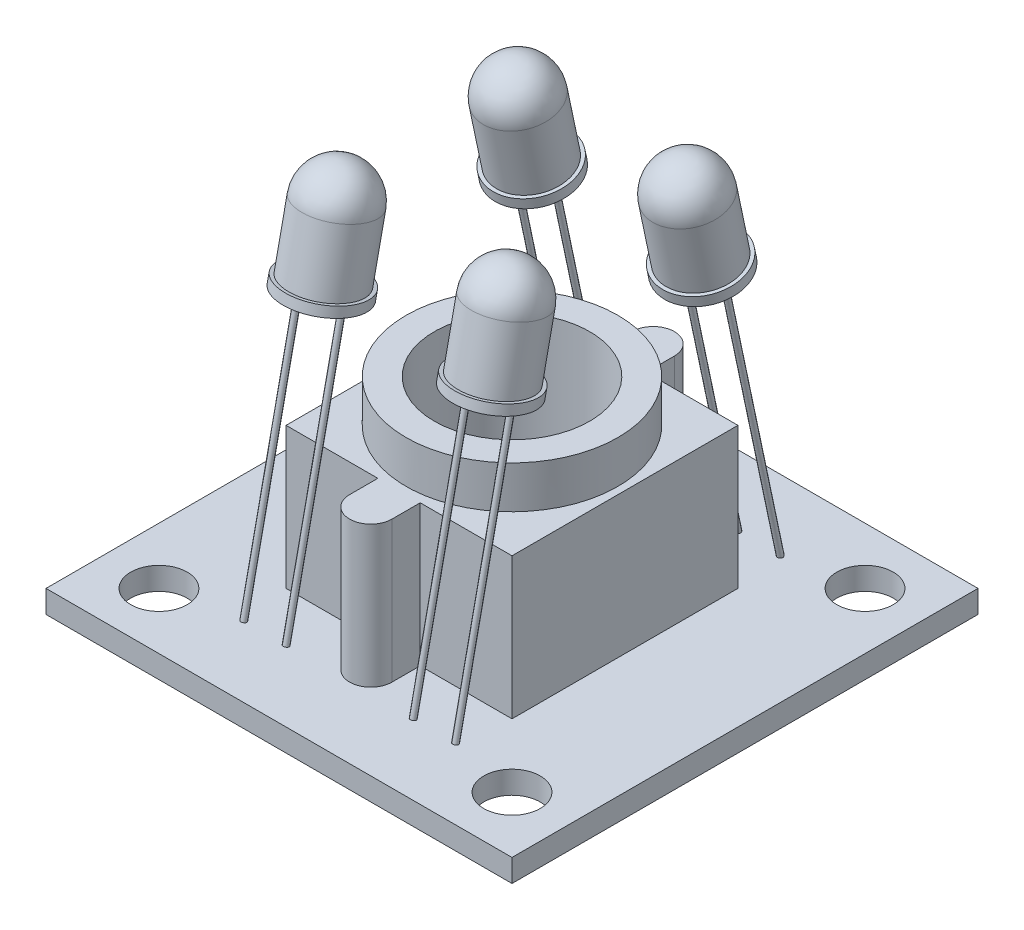
from build123d import *

# Parameters (mm, degrees)
SKETCH1_W                 = 33
SKETCH1_H                 = 33
SKETCH1_R                 = 2
BOSS_EXTRUDE1_DEPTH       = 1.6
SKETCH2_W                 = 16
SKETCH2_H                 = 16
BOSS_EXTRUDE2_DEPTH       = 10
BOSS_EXTRUDE3_START       = -10
BOSS_EXTRUDE3_DEPTH       = 10
SKETCH4_R                 = 7.5
SKETCH4_R_2               = 5.5
BOSS_EXTRUDE4_DEPTH       = 3
CUT_EXTRUDE1_START        = -8
SKETCH5_R                 = 5.5
CUT_EXTRUDE1_DEPTH        = 8
SKETCH7_R                 = 0.2
LPATTERN1_COUNT           = 2
LPATTERN1_PITCH           = 3
SKETCH8_R                 = 2.75
BOSS_EXTRUDE7_DEPTH       = 0.7
SKETCH9_R                 = 2.5
BOSS_EXTRUDE8_DEPTH       = 7
FILLET1_R                 = 2.5
LPATTERN2_COUNT           = 2
LPATTERN2_PITCH           = 12
LPATTERN2_COPY_1_SKETCH_R = 0.2
FILLET1_OF_LPATTERN2_R    = 2.5


# Read off the part's stored shape, not the designer's step: Mirror1
with BuildPart() as part:
    # Sketch1 → Boss-Extrude1 (new body)
    with BuildSketch(Plane(origin=(0, 0, 0), x_dir=(1, 0, 0), z_dir=(0, 1, 0))):
        Rectangle(SKETCH1_W, SKETCH1_H)
        with Locations(Location((-12.5, 12.5, 0), (0, 0, 270))):
            Circle(SKETCH1_R, mode=Mode.SUBTRACT)
        with Locations(Location((12.5, 12.5, 0), (0, 0, 270))):
            Circle(SKETCH1_R, mode=Mode.SUBTRACT)
        with Locations(Location((12.5, -12.5, 0), (0, 0, 270))):
            Circle(SKETCH1_R, mode=Mode.SUBTRACT)
        with Locations(Location((-12.5, -12.5, 0), (0, 0, 270))):
            Circle(SKETCH1_R, mode=Mode.SUBTRACT)
    extrude(amount=BOSS_EXTRUDE1_DEPTH)

    # Sketch2 → Boss-Extrude2 (add)
    with BuildSketch(Plane(origin=(0, 1.6, 0), x_dir=(1, 0, 0), z_dir=(0, 1, 0))):
        Rectangle(SKETCH2_W, SKETCH2_H)
    extrude(amount=BOSS_EXTRUDE2_DEPTH)

    # Sketch3 → Boss-Extrude3 (add)
    with BuildSketch(Plane(origin=(0, 11.6, 0), x_dir=(1, 0, 0), z_dir=(0, 1, 0)).offset(BOSS_EXTRUDE3_START)):
        with BuildLine():
            Line((-1.5, -10), (-1.5, 10))
            ThreePointArc((-1.5, 10), (0, 11.5), (1.5, 10))
            Line((1.5, 10), (1.5, -10))
            ThreePointArc((1.5, -10), (0, -11.5), (-1.5, -10))
        make_face()
    extrude(amount=BOSS_EXTRUDE3_DEPTH)

    # Sketch4 → Boss-Extrude4 (add)
    with BuildSketch(Plane(origin=(0, 11.6, 0), x_dir=(1, 0, 0), z_dir=(0, 1, 0))):
        with Locations(Location((0, 0, 0), (0, 0, 90))):
            Circle(SKETCH4_R)
        with Locations(Location((0, 0, 0), (0, 0, 270))):
            Circle(SKETCH4_R_2, mode=Mode.SUBTRACT)
    extrude(amount=BOSS_EXTRUDE4_DEPTH)

    # Sketch5 → Cut-Extrude1 (cut)
    with BuildSketch(Plane(origin=(0, 11.6, 0), x_dir=(1, 0, 0), z_dir=(0, 1, 0)).offset(CUT_EXTRUDE1_START)):
        with Locations(Location((0, 0, 0), (0, 0, 270))):
            Circle(SKETCH5_R)
    extrude(amount=CUT_EXTRUDE1_DEPTH, mode=Mode.SUBTRACT)

    # Sweep1: sweep along a path in Sketch6
    with BuildLine(Plane.ZY.offset(7.5)) as sweep1_path:
        Line((-11.5, 1.6), (-7.357383869, 21.166265142))
    # Sketch7 → Sweep1 (sweep)
    with BuildSketch(Plane(origin=(-7.5, 21.166265142, -7.357383869), x_dir=(1, 0, 0), z_dir=(0, 0.9783132570757084, 0.2071308065689869))):
        Circle(SKETCH7_R)
    sweep1 = sweep(path=sweep1_path.line)

    # LPattern1: Sweep1 ×2
    with Locations(*[(i * LPATTERN1_PITCH, 0, 0) for i in range(1, LPATTERN1_COUNT)]):
        add(sweep1)

    # Sketch8 → Boss-Extrude7 (add)
    with BuildSketch(Plane(origin=(0, 18.767273707, 3.973451767), x_dir=(1, 0, 0), z_dir=(0, 0.9783132570757084, 0.20713080656898694))):
        with Locations(Location((-6, 11.582011747, 0), (0, 0, 270))):
            Circle(SKETCH8_R)
    boss_extrude7 = extrude(amount=-BOSS_EXTRUDE7_DEPTH)

    # Sketch9 → Boss-Extrude8 (add)
    with BuildSketch(Plane(origin=(0, 18.767273707, 3.973451767), x_dir=(1, 0, 0), z_dir=(0, 0.9783132570757084, 0.20713080656898694))):
        with Locations(Location((-6, 11.582011747, 0), (0, 0, 270))):
            Circle(SKETCH9_R)
    boss_extrude8 = extrude(amount=BOSS_EXTRUDE8_DEPTH)

    # Fillet1
    fillet1_edges = [part.edges().sort_by_distance(p)[0] for p in [
        (-6, 28.532284957, -8.353251365),
    ]]
    fillet(fillet1_edges, radius=FILLET1_R)

    # LPattern2: Sweep1, Boss-Extrude7, Boss-Extrude8 ×2
    with Locations(*[(i * LPATTERN2_PITCH, 0, 0) for i in range(1, LPATTERN2_COUNT)]):
        add(sweep1)
        add(boss_extrude7)
        add(boss_extrude8)

    # LPattern2 copy 1: sweep along a path in LPattern2 copy 1 path
    with BuildLine(Plane.ZY.offset(-7.5)) as lpattern2_copy_1_path:
        Line((-11.5, 1.6), (-7.357383869, 21.166265142))
    # LPattern2 copy 1 sketch → LPattern2 copy 1 (sweep)
    with BuildSketch(Plane(origin=(7.5, 21.166265142, -7.357383869), x_dir=(1, 0, 0), z_dir=(0, 0.9783132570757084, 0.2071308065689869))):
        Circle(LPATTERN2_COPY_1_SKETCH_R)
    sweep(path=lpattern2_copy_1_path.line)

    # Fillet1 of LPattern2
    fillet1_of_lpattern2_edges = [part.edges().sort_by_distance(p)[0] for p in [
        (6, 28.532284957, -8.353251365),
    ]]
    fillet(fillet1_of_lpattern2_edges, radius=FILLET1_OF_LPATTERN2_R)

    # Mirror1: part across plane


with BuildPart() as part_1:
    add(part.part)
    add(part.part.mirror(Plane.XY))


solid = part_1.part
